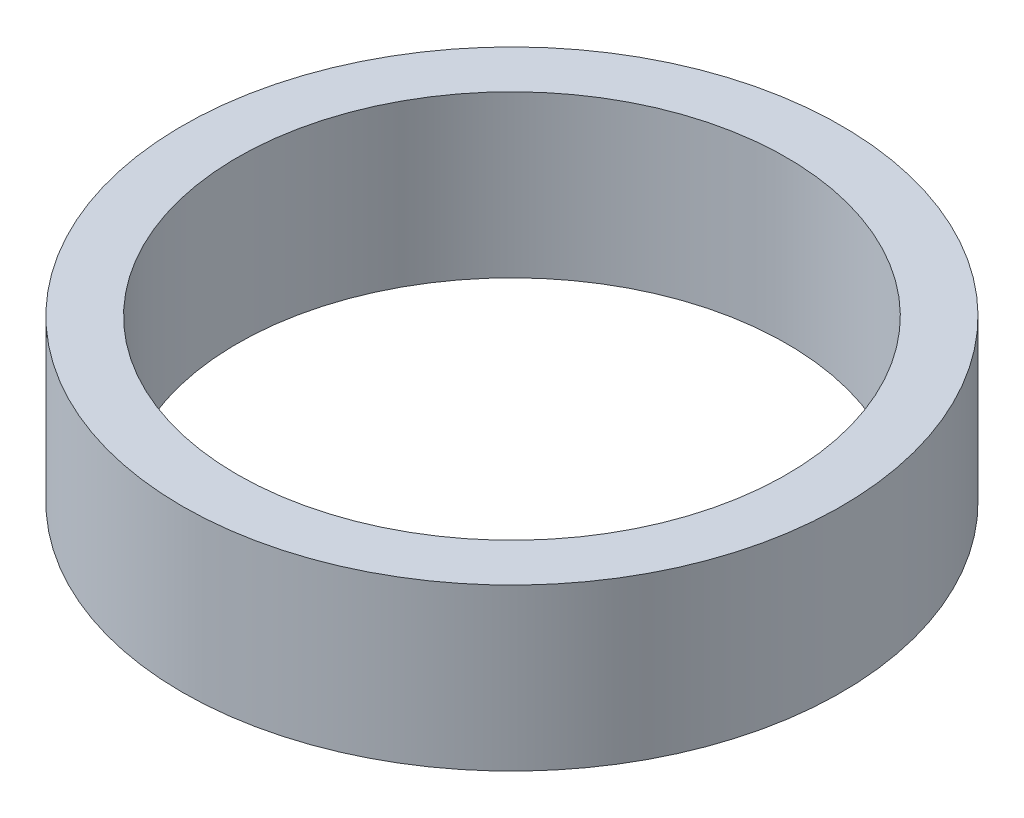
from build123d import *

# Parameters (mm, degrees)
SKETCH1_R           = 45
BOSS_EXTRUDE1_DEPTH = 22
SKETCH2_R           = 37.5
CUT_EXTRUDE1_DEPTH  = 68.334983478


with BuildPart() as part:
    # Sketch1 → Boss-Extrude1 (new body)
    with BuildSketch(Plane(origin=(0, 0, 0), x_dir=(1, 0, 0), z_dir=(0, 1, 0))):
        Circle(SKETCH1_R)
    extrude(amount=BOSS_EXTRUDE1_DEPTH)

    # Sketch2 → Cut-Extrude1 (cut, through all)
    with BuildSketch(Plane(origin=(0, 0, 0), x_dir=(1, 0, 0), z_dir=(0, 1, 0))):
        Circle(SKETCH2_R)
    extrude(amount=CUT_EXTRUDE1_DEPTH, mode=Mode.SUBTRACT)


solid = part.part
